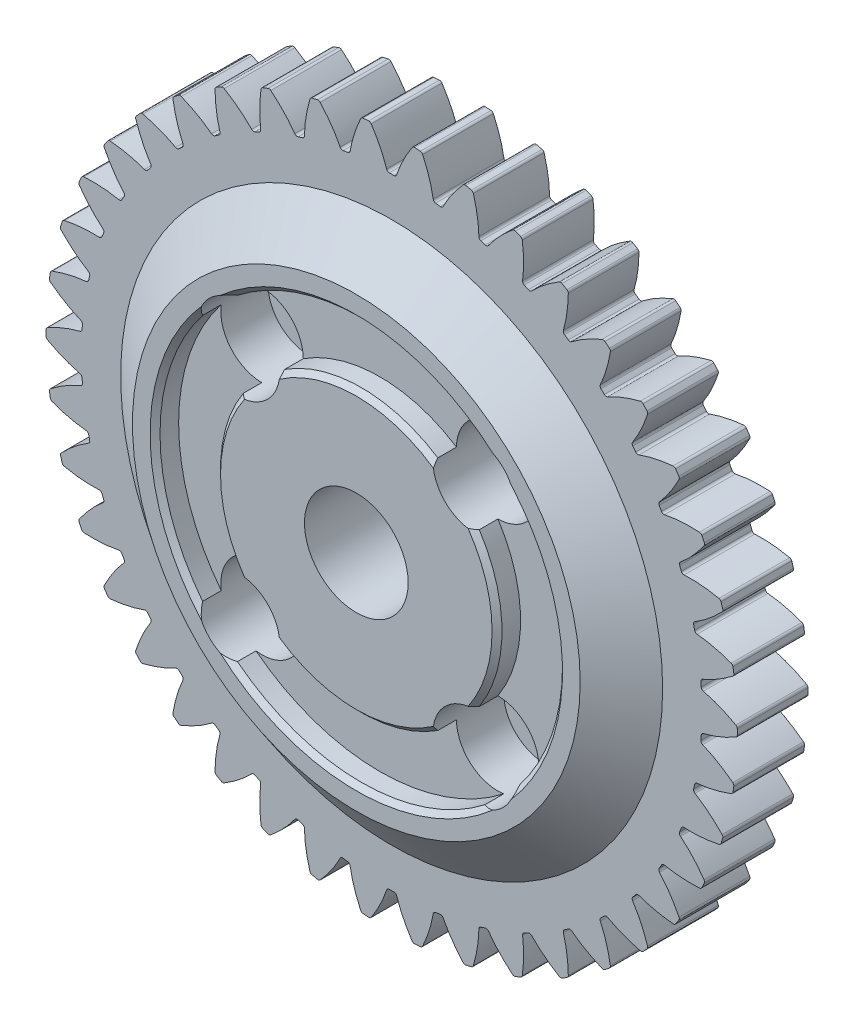
from build123d import *

# Parameters (mm, degrees)
SKETCH1_R                                        = 46.566666667
BOSS_EXTRUDE1_DEPTH                              = 9.525
CUT_EXTRUDE_DCGTBC_DEPTH                         = 67.540472751
FILLET_TIP_DCGTBC_R                              = 0.376401082
CIRPATTERN_DCGTBC_COUNT                          = 42
FILLET_TIP_DCGTBC_OF_CIRPATTERN_DCGTBC_R         = 0.376401082
CBORE_FOR_1_4_SOCKET_HEAD_CAP_SCREW1_D           = 6.7564
CBORE_FOR_1_4_SOCKET_HEAD_CAP_SCREW1_CBORE_D     = 11.1125
CBORE_FOR_1_4_SOCKET_HEAD_CAP_SCREW1_CBORE_DEPTH = 6.35
F_3_8_CLEARANCE_HOLE1_D                          = 13.97
SKETCH31_R                                       = 30.1625
BOSS_EXTRUDE3_DEPTH                              = 4.7625
SKETCH32_R                                       = 26.9875
SKETCH32_R_2                                     = 19.0881
CUT_EXTRUDE11_DEPTH                              = 3.175
CHAMFER2_SIZE                                    = 0.79375
MOVE_START                                       = 11.1125
MOVE_FACE3_OUTLINE_R                             = 27.1145
MOVE_FACE3_OUTLINE_R_2                           = 26.9875
MOVE_FACE3_OUTLINE_R_3                           = 19.0881
MOVE_FACE3_OUTLINE_R_4                           = 18.9611
MOVE_FACE3_DEPTH                                 = 2.5082501
CUT_EXTRUDE12_DEPTH                              = 68.316731008
CUT_EXTRUDE12_DEPTH_BACK                         = 68.316731008
SKETCH33_R                                       = 6.985
SKETCH29_R                                       = 5.55625
CUT_EXTRUDE13_DEPTH                              = 67.469054787
MOVE_FACE2_BY                                    = 1.5875
MOVE_FACE2_2_BY                                  = 1.5875
MOVE_FACE2_3_BY                                  = 1.5875
MOVE_FACE2_4_BY                                  = 1.5875


# Read off the part's stored shape, not the designer's step: Move Face3
with BuildPart() as part:
    # Sketch1 → Boss-Extrude1 (new body)
    with BuildSketch(Plane.XY):
        with Locations(Location((0, 0, 0), (0, 0, 180))):
            Circle(SKETCH1_R)
    extrude(amount=BOSS_EXTRUDE1_DEPTH)

    # DCGTBC → Cut-Extrude-DCGTBC (cut, through all)
    with BuildSketch(Plane.XY):
        with BuildLine():
            add(Edge.make_bspline(
                [(0.594095182, 41.799944995), (0.605165342, 41.837791012), (0.630956184, 41.924432204), (0.685622088, 42.101143206), (0.775689366, 42.373041482), (0.894377822, 42.702276772), (1.03980911, 43.074001724), (1.199558374, 43.450890909), (1.366213871, 43.820081404), (1.545430422, 44.191018437), (1.726505394, 44.548434456), (1.925623821, 44.917358174), (2.11503879, 45.256724466), (2.339403701, 45.634188432), (2.524021751, 45.938016713), (2.724819808, 46.249459895), (2.824035766, 46.400680198), (2.875366514, 46.477808811)],
                knots=[0.207762282, 0.207762282, 0.207762282, 0.207762282, 0.207762282, 0.228941013, 0.256307345, 0.307035032, 0.361767352, 0.416499661, 0.471231937, 0.525964282, 0.580696616, 0.635428982, 0.690161387, 0.744893688, 0.799626082, 0.854358407, 0.909090915, 0.909090915, 0.909090915, 0.909090915, 0.909090915], degree=4))
            ThreePointArc((2.875366514, 46.477808811), (0, 46.566666667), (-2.875366514, 46.477808811))
            add(Edge.make_bspline(
                [(-0.594095182, 41.799944995), (-0.605165342, 41.837791012), (-0.630956184, 41.924432204), (-0.685622088, 42.101143206), (-0.775689366, 42.373041482), (-0.894377822, 42.702276772), (-1.03980911, 43.074001724), (-1.199558374, 43.450890909), (-1.366213871, 43.820081404), (-1.545430422, 44.191018437), (-1.726505394, 44.548434456), (-1.925623821, 44.917358174), (-2.11503879, 45.256724466), (-2.339403701, 45.634188432), (-2.524021751, 45.938016713), (-2.724819808, 46.249459895), (-2.824035766, 46.400680198), (-2.875366514, 46.477808811)],
                knots=[0.207762282, 0.207762282, 0.207762282, 0.207762282, 0.207762282, 0.228941013, 0.256307345, 0.307035032, 0.361767352, 0.416499661, 0.471231937, 0.525964282, 0.580696616, 0.635428982, 0.690161387, 0.744893688, 0.799626082, 0.854358407, 0.909090915, 0.909090915, 0.909090915, 0.909090915, 0.909090915], degree=4))
            ThreePointArc((-0.594095182, 41.799944995), (0, 41.804166667), (0.594095182, 41.799944995))
        make_face()
    cut_extrude_dcgtbc = extrude(amount=CUT_EXTRUDE_DCGTBC_DEPTH, mode=Mode.SUBTRACT)

    # Fillet-Tip-DCGTBC
    fillet_tip_dcgtbc_edges = [part.edges().sort_by_distance(p)[0] for p in [
        (2.875366514, 46.477808811, 4.7625),
        (-2.875366514, 46.477808811, 4.7625),
        (0.594095182, 41.799944995, 4.7625),
        (-0.594095182, 41.799944995, 4.7625),
    ]]
    fillet(fillet_tip_dcgtbc_edges, radius=FILLET_TIP_DCGTBC_R)

    # CirPattern-DCGTBC: Cut-Extrude-DCGTBC ×42 about axis
    cirpattern_dcgtbc_axis = Axis((0, 0, 9.525), (0, 0, 1))
    for i in range(1, CIRPATTERN_DCGTBC_COUNT):
        add(cut_extrude_dcgtbc.rotate(cirpattern_dcgtbc_axis, i * 360 / CIRPATTERN_DCGTBC_COUNT), mode=Mode.SUBTRACT)

    # Fillet-Tip-DCGTBC of CirPattern-DCGTBC
    fillet_tip_dcgtbc_of_cirpattern_dcgtbc_edges = [part.edges().sort_by_distance(p)[0] for p in [
        (-4.083906906, 46.387241229, 4.7625),
        (-9.770408998, 45.530138946, 4.7625),
        (-5.642498899, 41.421619438, 4.7625),
        (-6.817418157, 41.244528854, 4.7625),
        (-10.951952595, 45.260459331, 4.7625),
        (-16.44719669, 43.565401014, 4.7625),
        (-11.753048878, 40.11800335, 4.7625),
        (-12.888451277, 39.767778092, 4.7625),
        (-17.57534976, 43.122633561, 4.7625),
        (-22.756581186, 40.627484012, 4.7625),
        (-17.601055166, 37.91821736, 4.7625),
        (-18.671577693, 37.402680882, 4.7625),
        (-23.806142653, 40.021519417, 4.7625),
        (-28.557621262, 36.782016153, 4.7625),
        (-23.055882967, 34.871401052, 4.7625),
        (-24.037611917, 34.202069587, 4.7625),
        (-29.505145659, 36.026390661, 4.7625),
        (-33.72073127, 32.114898833, 4.7625),
        (-27.995680441, 31.045615267, 4.7625),
        (-28.866685611, 30.237440575, 4.7625),
        (-34.545052466, 31.226491871, 4.7625),
        (-38.130575863, 26.730387742, 4.7625),
        (-32.310100676, 26.526321739, 4.7625),
        (-33.05092525, 25.597357106, 4.7625),
        (-38.813279885, 25.729044852, 4.7625),
        (-41.6886464, 20.748763959, 4.7625),
        (-35.902766652, 21.414474017, 4.7625),
        (-36.496861834, 20.385470978, 4.7625),
        (-42.214482769, 19.656853487, 4.7625),
        (-44.315461464, 14.303647075, 4.7625),
        (-38.693424149, 15.824262332, 4.7625),
        (-39.127518833, 14.718207114, 4.7625),
        (-44.672683864, 13.145560497, 4.7625),
        (-45.952342349, 7.539010352, 4.7625),
        (-40.619734489, 9.880562775, 4.7625),
        (-40.884131718, 8.722162825, 4.7625),
        (-46.132971022, 6.340617408, 4.7625),
        (-46.562723839, 0.605964596, 4.7625),
        (-41.638667083, 3.716147772, 4.7625),
        (-41.72746066, 2.53127983, 4.7625),
        (-46.562723839, -0.605964596, 4.7625),
        (-46.132971022, -6.340617408, 4.7625),
        (-41.72746066, -2.53127983, 4.7625),
        (-41.638667083, -3.716147772, 4.7625),
        (-45.952342349, -7.539010352, 4.7625),
        (-44.672683864, -13.145560497, 4.7625),
        (-40.884131718, -8.722162825, 4.7625),
        (-40.619734489, -9.880562775, 4.7625),
        (-44.315461464, -14.303647075, 4.7625),
        (-42.214482769, -19.656853487, 4.7625),
        (-39.127518833, -14.718207114, 4.7625),
        (-38.693424149, -15.824262332, 4.7625),
        (-41.6886464, -20.748763959, 4.7625),
        (-38.813279885, -25.729044852, 4.7625),
        (-36.496861834, -20.385470978, 4.7625),
        (-35.902766652, -21.414474017, 4.7625),
        (-38.130575863, -26.730387742, 4.7625),
        (-34.545052466, -31.226491871, 4.7625),
        (-33.05092525, -25.597357106, 4.7625),
        (-32.310100676, -26.526321739, 4.7625),
        (-33.72073127, -32.114898833, 4.7625),
        (-29.505145659, -36.026390661, 4.7625),
        (-28.866685611, -30.237440575, 4.7625),
        (-27.995680441, -31.045615267, 4.7625),
        (-28.557621262, -36.782016153, 4.7625),
        (-23.806142653, -40.021519417, 4.7625),
        (-24.037611917, -34.202069587, 4.7625),
        (-23.055882967, -34.871401052, 4.7625),
        (-22.756581186, -40.627484012, 4.7625),
        (-17.57534976, -43.122633561, 4.7625),
        (-18.671577693, -37.402680882, 4.7625),
        (-17.601055166, -37.91821736, 4.7625),
        (-16.44719669, -43.565401014, 4.7625),
        (-10.951952595, -45.260459331, 4.7625),
        (-12.888451277, -39.767778092, 4.7625),
        (-11.753048878, -40.11800335, 4.7625),
        (-9.770408998, -45.530138946, 4.7625),
        (-4.083906906, -46.387241229, 4.7625),
        (-6.817418157, -41.244528854, 4.7625),
        (-5.642498899, -41.421619438, 4.7625),
        (-2.875366514, -46.477808811, 4.7625),
        (2.875366514, -46.477808811, 4.7625),
        (-0.594095182, -41.799944995, 4.7625),
        (0.594095182, -41.799944995, 4.7625),
        (4.083906906, -46.387241229, 4.7625),
        (9.770408998, -45.530138946, 4.7625),
        (5.642498899, -41.421619438, 4.7625),
        (6.817418157, -41.244528854, 4.7625),
        (10.951952595, -45.260459331, 4.7625),
        (16.44719669, -43.565401014, 4.7625),
        (11.753048878, -40.11800335, 4.7625),
        (12.888451277, -39.767778092, 4.7625),
        (17.57534976, -43.122633561, 4.7625),
        (22.756581186, -40.627484012, 4.7625),
        (17.601055166, -37.91821736, 4.7625),
        (18.671577693, -37.402680882, 4.7625),
        (23.806142653, -40.021519417, 4.7625),
        (28.557621262, -36.782016153, 4.7625),
        (23.055882967, -34.871401052, 4.7625),
        (24.037611917, -34.202069587, 4.7625),
        (29.505145659, -36.026390661, 4.7625),
        (33.72073127, -32.114898833, 4.7625),
        (27.995680441, -31.045615267, 4.7625),
        (28.866685611, -30.237440575, 4.7625),
        (34.545052466, -31.226491871, 4.7625),
        (38.130575863, -26.730387742, 4.7625),
        (32.310100676, -26.526321739, 4.7625),
        (33.05092525, -25.597357106, 4.7625),
        (38.813279885, -25.729044852, 4.7625),
        (41.6886464, -20.748763959, 4.7625),
        (35.902766652, -21.414474017, 4.7625),
        (36.496861834, -20.385470978, 4.7625),
        (42.214482769, -19.656853487, 4.7625),
        (44.315461464, -14.303647075, 4.7625),
        (38.693424149, -15.824262332, 4.7625),
        (39.127518833, -14.718207114, 4.7625),
        (44.672683864, -13.145560497, 4.7625),
        (45.952342349, -7.539010352, 4.7625),
        (40.619734489, -9.880562775, 4.7625),
        (40.884131718, -8.722162825, 4.7625),
        (46.132971022, -6.340617408, 4.7625),
        (46.562723839, -0.605964596, 4.7625),
        (41.638667083, -3.716147772, 4.7625),
        (41.72746066, -2.53127983, 4.7625),
        (46.562723839, 0.605964596, 4.7625),
        (46.132971022, 6.340617408, 4.7625),
        (41.72746066, 2.53127983, 4.7625),
        (41.638667083, 3.716147772, 4.7625),
        (45.952342349, 7.539010352, 4.7625),
        (44.672683864, 13.145560497, 4.7625),
        (40.884131718, 8.722162825, 4.7625),
        (40.619734489, 9.880562775, 4.7625),
        (44.315461464, 14.303647075, 4.7625),
        (42.214482769, 19.656853487, 4.7625),
        (39.127518833, 14.718207114, 4.7625),
        (38.693424149, 15.824262332, 4.7625),
        (41.6886464, 20.748763959, 4.7625),
        (38.813279885, 25.729044852, 4.7625),
        (36.496861834, 20.385470978, 4.7625),
        (35.902766652, 21.414474017, 4.7625),
        (38.130575863, 26.730387742, 4.7625),
        (34.545052466, 31.226491871, 4.7625),
        (33.05092525, 25.597357106, 4.7625),
        (32.310100676, 26.526321739, 4.7625),
        (33.72073127, 32.114898833, 4.7625),
        (29.505145659, 36.026390661, 4.7625),
        (28.866685611, 30.237440575, 4.7625),
        (27.995680441, 31.045615267, 4.7625),
        (28.557621262, 36.782016153, 4.7625),
        (23.806142653, 40.021519417, 4.7625),
        (24.037611917, 34.202069587, 4.7625),
        (23.055882967, 34.871401052, 4.7625),
        (22.756581186, 40.627484012, 4.7625),
        (17.57534976, 43.122633561, 4.7625),
        (18.671577693, 37.402680882, 4.7625),
        (17.601055166, 37.91821736, 4.7625),
        (16.44719669, 43.565401014, 4.7625),
        (10.951952595, 45.260459331, 4.7625),
        (12.888451277, 39.767778092, 4.7625),
        (11.753048878, 40.11800335, 4.7625),
        (9.770408998, 45.530138946, 4.7625),
        (4.083906906, 46.387241229, 4.7625),
        (6.817418157, 41.244528854, 4.7625),
        (5.642498899, 41.421619438, 4.7625),
    ]]
    fillet(fillet_tip_dcgtbc_of_cirpattern_dcgtbc_edges, radius=FILLET_TIP_DCGTBC_OF_CIRPATTERN_DCGTBC_R)

    # CBORE for 1/4 Socket Head Cap Screw1 (through all)
    with Locations(Plane.XY.offset(9.525)):
        with Locations((-15.875, 15.875), (15.875, 15.875), (15.875, -15.875), (-15.875, -15.875)):
            CounterBoreHole(CBORE_FOR_1_4_SOCKET_HEAD_CAP_SCREW1_D / 2, CBORE_FOR_1_4_SOCKET_HEAD_CAP_SCREW1_CBORE_D / 2, CBORE_FOR_1_4_SOCKET_HEAD_CAP_SCREW1_CBORE_DEPTH)

    # 3/8 Clearance Hole1 (through all)
    with Locations(Plane.XY.offset(9.525)):
        with Locations((0, 0)):
            Hole(F_3_8_CLEARANCE_HOLE1_D / 2)

    # Sketch31 → Boss-Extrude3 (add)
    with BuildSketch(Plane.XY.offset(9.525)):
        Circle(SKETCH31_R)
    extrude(amount=BOSS_EXTRUDE3_DEPTH)

    # Sketch32 → Cut-Extrude11 (cut)
    with BuildSketch(Plane.XY.offset(14.2875)):
        Circle(SKETCH32_R)
        Circle(SKETCH32_R_2, mode=Mode.SUBTRACT)
    extrude(amount=-CUT_EXTRUDE11_DEPTH, mode=Mode.SUBTRACT)

    # Chamfer2
    chamfer2_edges = [part.edges().sort_by_distance(p)[0] for p in [
        (-26.9875, 0, 14.2875),
        (-19.0881, 0, 14.2875),
    ]]
    chamfer(chamfer2_edges, length=CHAMFER2_SIZE)

    # Move Face3 outline → Move Face3 (cut)
    # profile 1 of 2: a face of its own
    with BuildSketch(Plane.XY.offset(MOVE_START)):
        Circle(MOVE_FACE3_OUTLINE_R)
        Circle(MOVE_FACE3_OUTLINE_R_2, mode=Mode.SUBTRACT)
    # profile 2 of 2: a face of its own
    with BuildSketch(Plane.XY.offset(MOVE_START)):
        Circle(MOVE_FACE3_OUTLINE_R_3)
        Circle(MOVE_FACE3_OUTLINE_R_4, mode=Mode.SUBTRACT)
    extrude(amount=MOVE_FACE3_DEPTH, mode=Mode.SUBTRACT)

    # Sketch33 → Cut-Extrude12 (cut, two sides: drawn at the far end of the back side and taken through both)
    with BuildSketch(Plane.XY.offset(-CUT_EXTRUDE12_DEPTH_BACK)):
        Circle(SKETCH33_R)
    extrude(amount=CUT_EXTRUDE12_DEPTH + CUT_EXTRUDE12_DEPTH_BACK, mode=Mode.SUBTRACT)

    # Sketch29 → Cut-Extrude13 (cut, through all)
    with BuildSketch(Plane.XY.offset(9.525)):
        with Locations((-15.875, 15.875)):
            Circle(SKETCH29_R)
        with Locations((-15.875, -15.875)):
            Circle(SKETCH29_R)
        with Locations((15.875, -15.875)):
            Circle(SKETCH29_R)
        with Locations((15.875, 15.875)):
            Circle(SKETCH29_R)
    extrude(amount=CUT_EXTRUDE13_DEPTH, mode=Mode.SUBTRACT)

    # Move Face2: a face moved outward by 1.5875
    extrude(part.faces().sort_by_distance((-15.875, -20.32, 3.175))[0], amount=MOVE_FACE2_BY, dir=(0, 0, 1))

    # Move Face2 2: a face moved outward by 1.5875
    extrude(part.faces().sort_by_distance((15.875, -20.32, 3.175))[0], amount=MOVE_FACE2_2_BY, dir=(0, 0, 1))

    # Move Face2 3: a face moved outward by 1.5875
    extrude(part.faces().sort_by_distance((15.875, 11.43, 3.175))[0], amount=MOVE_FACE2_3_BY, dir=(0, 0, 1))

    # Move Face2 4: a face moved outward by 1.5875
    extrude(part.faces().sort_by_distance((-15.875, 11.43, 3.175))[0], amount=MOVE_FACE2_4_BY, dir=(0, 0, 1))

    # Sketch35 → Revolve1 (revolve)
    with BuildSketch(Plane(origin=(0, 0, 0), x_dir=(1, 0, 0), z_dir=(0, 1, 0))):
        Polygon((30.1625, -14.2875), (30.1625, -9.525), (36.5125, -9.525), align=None)
    revolve(axis=Axis((0, 0, 9.525), (0, 0, -1)))


solid = part.part
